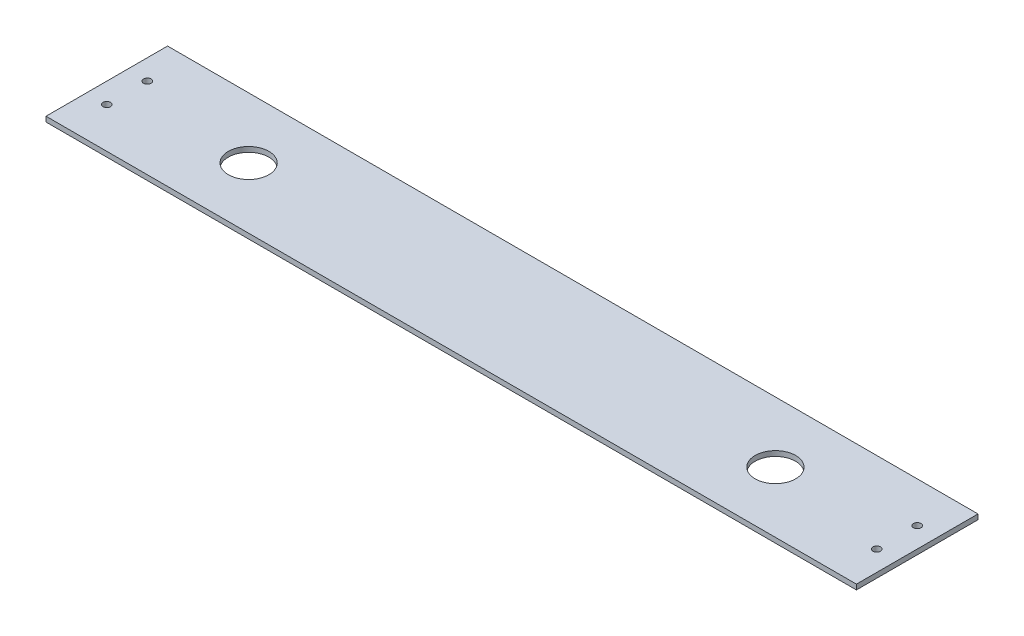
from build123d import *

# Parameters (mm, degrees)
SKETCH1_W               = 508
SKETCH1_H               = 76.2
BOSS_EXTRUDE1_DEPTH     = 3.175
SKETCH3_R               = 2.38125
CUT_EXTRUDE2_DEPTH      = 3.175
CUT_EXTRUDE3_DEPTH      = 257.861228341
CUT_EXTRUDE3_DEPTH_BACK = 257.861228341
SKETCH4_R               = 12.7


with BuildPart() as part:
    # Sketch1 → Boss-Extrude1 (new body)
    with BuildSketch(Plane(origin=(0, 0, 0), x_dir=(1, 0, 0), z_dir=(0, 1, 0))):
        Rectangle(SKETCH1_W, SKETCH1_H)
    extrude(amount=BOSS_EXTRUDE1_DEPTH)

    # Sketch3 → Cut-Extrude2 (cut)
    with BuildSketch(Plane(origin=(0, 3.175, 0), x_dir=(1, 0, 0), z_dir=(0, 1, 0))):
        with Locations((-241.3, 12.7)):
            Circle(SKETCH3_R)
        with Locations((-241.3, -12.7)):
            Circle(SKETCH3_R)
        with Locations((241.3, -12.7)):
            Circle(SKETCH3_R)
        with Locations((241.3, 12.7)):
            Circle(SKETCH3_R)
    extrude(amount=-CUT_EXTRUDE2_DEPTH, mode=Mode.SUBTRACT)

    # Sketch4 → Cut-Extrude3 (cut, two sides: drawn at the far end of the back side and taken through both)
    with BuildSketch(Plane(origin=(0, 3.175, 0), x_dir=(1, 0, 0), z_dir=(0, 1, 0)).offset(-CUT_EXTRUDE3_DEPTH_BACK)):
        with Locations((-165.1, 0)):
            Circle(SKETCH4_R)
        with Locations((165.1, 0)):
            Circle(SKETCH4_R)
    extrude(amount=CUT_EXTRUDE3_DEPTH + CUT_EXTRUDE3_DEPTH_BACK, mode=Mode.SUBTRACT)


solid = part.part
